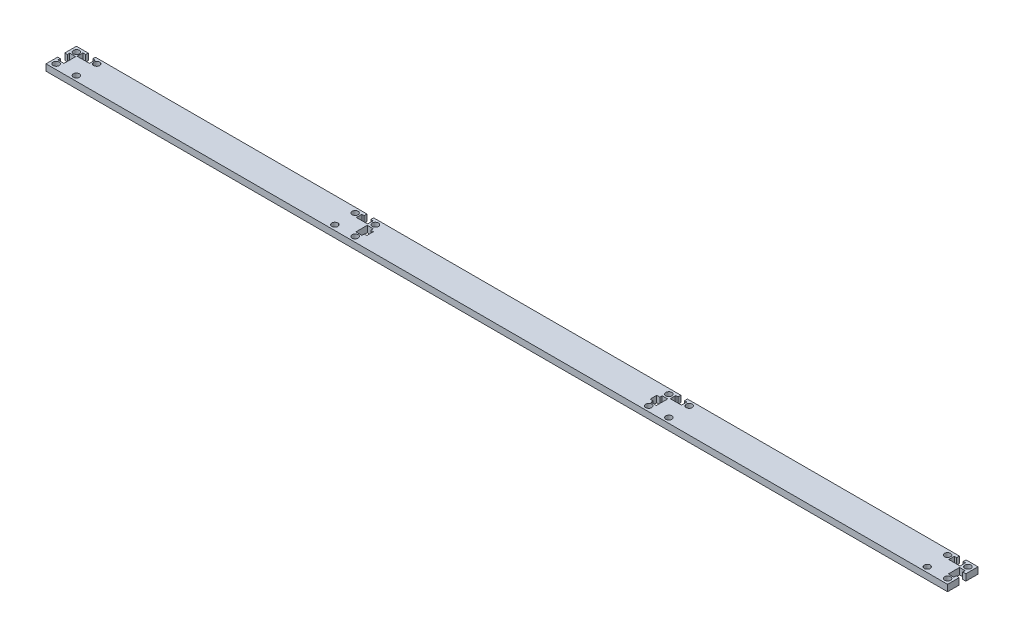
from build123d import *

# Parameters (mm, degrees)
SKETCH1_R           = 1.5
BOSS_EXTRUDE1_DEPTH = 3.175
CUT_EXTRUDE2_DEPTH  = 10
SKETCH6_W           = 2.65
SKETCH6_H           = 3.175
CUT_EXTRUDE3_DEPTH  = 0.25
CUT_EXTRUDE4_DEPTH  = 10
SKETCH10_W          = 5.8
SKETCH10_H          = 3.175
CUT_EXTRUDE5_DEPTH  = 0.762
SKETCH11_W          = 5.642946696
SKETCH11_H          = 3.772309887
CUT_EXTRUDE8_DEPTH  = 0.762
CUT_EXTRUDE10_DEPTH = 40.762
SKETCH16_W          = 5.568555148
SKETCH16_H          = 0.762
CUT_EXTRUDE12_DEPTH = 10.762
SKETCH17_W          = 0.762
SKETCH17_H          = 5.563896413
CUT_EXTRUDE13_DEPTH = 10.762
SKETCH18_W          = 5.525633157
SKETCH18_H          = 0.762
CUT_EXTRUDE14_DEPTH = 10.762
SKETCH19_W          = 0.762
SKETCH19_H          = 5.528063786
CUT_EXTRUDE15_DEPTH = 10.762
SKETCH20_W          = 5.526041358
SKETCH20_H          = 0.762
CUT_EXTRUDE16_DEPTH = 10.762
SKETCH21_W          = 3.556
SKETCH21_H          = 1.27
CUT_EXTRUDE17_DEPTH = 10.762
SKETCH22_W          = 6.120137849
SKETCH22_H          = 2.839580983
CUT_EXTRUDE18_DEPTH = 10


with BuildPart() as part:
    # Sketch1 → Boss-Extrude1 (new body)
    with BuildSketch(Plane(origin=(0, 0, 0), x_dir=(1, 0, 0), z_dir=(0, 1, 0))):
        Polygon((0, 7.5), (0, 0), (444.5, 0), (444.5, 15), (0, 15), align=None)
        with Locations((2.5, 2.5)):
            Circle(SKETCH1_R, mode=Mode.SUBTRACT)
        with Locations((12.5, 2.5)):
            Circle(SKETCH1_R, mode=Mode.SUBTRACT)
        with Locations((2.5, 12.5)):
            Circle(SKETCH1_R, mode=Mode.SUBTRACT)
        with Locations((12.5, 12.5)):
            Circle(SKETCH1_R, mode=Mode.SUBTRACT)
        with Locations((139.9, 2.5)):
            Circle(SKETCH1_R, mode=Mode.SUBTRACT)
        with Locations((149.9, 2.5)):
            Circle(SKETCH1_R, mode=Mode.SUBTRACT)
        with Locations((139.9, 12.5)):
            Circle(SKETCH1_R, mode=Mode.SUBTRACT)
        with Locations((149.9, 12.5)):
            Circle(SKETCH1_R, mode=Mode.SUBTRACT)
        with Locations((442, 12.5)):
            Circle(SKETCH1_R, mode=Mode.SUBTRACT)
        with Locations((294.6, 2.5)):
            Circle(SKETCH1_R, mode=Mode.SUBTRACT)
        with Locations((304.6, 2.5)):
            Circle(SKETCH1_R, mode=Mode.SUBTRACT)
        with Locations((432, 2.5)):
            Circle(SKETCH1_R, mode=Mode.SUBTRACT)
        with Locations((442, 2.5)):
            Circle(SKETCH1_R, mode=Mode.SUBTRACT)
        with Locations((294.6, 12.5)):
            Circle(SKETCH1_R, mode=Mode.SUBTRACT)
        with Locations((304.6, 12.5)):
            Circle(SKETCH1_R, mode=Mode.SUBTRACT)
        with Locations((432, 12.5)):
            Circle(SKETCH1_R, mode=Mode.SUBTRACT)
    extrude(amount=BOSS_EXTRUDE1_DEPTH)

    # Sketch4 → Cut-Extrude2 (cut)
    with BuildSketch(Plane(origin=(0, 3.175, 0), x_dir=(1, 0, 0), z_dir=(0, 1, 0))):
        Polygon((444.5, 5.75), (444.5, 9), (442.2, 9), (442.2, 10.15), (440.5, 10.15), (440.5, 7.5), (440.25, 7.5), (440.25, 4.6), (442.45, 4.6), (442.45, 5.75), align=None)
        Polygon((2.05, 9.25), (0, 9.25), (0, 5.75), (2.05, 5.75), (2.05, 4.6), (4.25, 4.6), (4.25, 10.4), (2.05, 10.4), align=None)
    extrude(amount=-CUT_EXTRUDE2_DEPTH, mode=Mode.SUBTRACT)

    # Sketch6 → Cut-Extrude3 (cut)
    with BuildSketch(Plane(origin=(440.5, 0, 0), x_dir=(0, 0, -1), z_dir=(1, 0, 0))):
        with Locations((8.825, 1.5875)):
            Rectangle(SKETCH6_W, SKETCH6_H)
    extrude(amount=-CUT_EXTRUDE3_DEPTH, mode=Mode.SUBTRACT)

    # Sketch7 → Cut-Extrude4 (cut)
    with BuildSketch(Plane(origin=(0, 3.175, 0), x_dir=(1, 0, 0), z_dir=(0, 1, 0))):
        Polygon((440.25, 10.15), (440.25, 4.6), (442.45, 4.6), (442.45, 5.75), (444.5, 5.75), (444.5, 9), (442.2, 9), (442.2, 10.15), align=None)
        Polygon((146.5, 13.1), (146.5, 15), (143.25, 15), (143.25, 12.85), (142.1, 12.85), (142.1, 10.9), (147.65, 10.9), (147.65, 13.1), align=None)
        Polygon((301.25, 12.85), (301.25, 15), (298, 15), (298, 13.1), (296.85, 13.1), (296.85, 10.9), (302.4, 10.9), (302.4, 12.85), align=None)
        Polygon((439.75, 10.9), (439.75, 13.1), (438.6, 13.1), (438.6, 15), (435.35, 15), (435.35, 12.85), (434.2, 12.85), (434.2, 10.9), align=None)
        Polygon((294.15, 5.75), (294.15, 4.6), (296.35, 4.6), (296.35, 10.15), (294.4, 10.15), (294.4, 9), (292.1, 9), (292.1, 5.75), align=None)
        Polygon((148.15, 10.15), (148.15, 4.6), (150.35, 4.6), (150.35, 5.75), (152.4, 5.75), (152.4, 9), (150.1, 9), (150.1, 10.15), align=None)
    extrude(amount=-CUT_EXTRUDE4_DEPTH, mode=Mode.SUBTRACT)

    # Sketch10 → Cut-Extrude5 (cut)
    with BuildSketch(Plane(origin=(2.05, 0, 0), x_dir=(0, 0, -1), z_dir=(1, 0, 0))):
        with Locations((7.5, 1.5875)):
            Rectangle(SKETCH10_W, SKETCH10_H)
    extrude(amount=-CUT_EXTRUDE5_DEPTH, mode=Mode.SUBTRACT)

    # Sketch11 → Cut-Extrude8 (cut)
    with BuildSketch(Plane.ZY.offset(-150.35)):
        with Locations((-7.421473348, 1.288845057)):
            Rectangle(SKETCH11_W, SKETCH11_H)
    extrude(amount=-CUT_EXTRUDE8_DEPTH, mode=Mode.SUBTRACT)

    # Sketch13 → Cut-Extrude10 (cut)
    with BuildSketch(Plane(origin=(0, 3.175, 0), x_dir=(1, 0, 0), z_dir=(0, 1, 0))):
        Polygon((151.112, 9.973556377), (151.112, 10.242946696), (148.15, 10.242946696), (148.15, 9.973556377), (149.018543237, 9.973556377), (149.018543237, 8.939623572), (150.569442445, 8.939623572), (150.569442445, 9.973556377), align=None)
    extrude(amount=-CUT_EXTRUDE10_DEPTH, mode=Mode.SUBTRACT)

    # Sketch16 → Cut-Extrude12 (cut)
    with BuildSketch(Plane(origin=(0, 3.175, 0), x_dir=(1, 0, 0), z_dir=(0, 1, 0))):
        with Locations((144.884277574, 13.231)):
            Rectangle(SKETCH16_W, SKETCH16_H)
    extrude(amount=-CUT_EXTRUDE12_DEPTH, mode=Mode.SUBTRACT)

    # Sketch17 → Cut-Extrude13 (cut)
    with BuildSketch(Plane(origin=(0, 3.175, 0), x_dir=(1, 0, 0), z_dir=(0, 1, 0))):
        with Locations((294.019, 7.368051794)):
            Rectangle(SKETCH17_W, SKETCH17_H)
    extrude(amount=-CUT_EXTRUDE13_DEPTH, mode=Mode.SUBTRACT)

    # Sketch18 → Cut-Extrude14 (cut)
    with BuildSketch(Plane(origin=(0, 3.175, 0), x_dir=(1, 0, 0), z_dir=(0, 1, 0))):
        with Locations((299.637183422, 13.231)):
            Rectangle(SKETCH18_W, SKETCH18_H)
    extrude(amount=-CUT_EXTRUDE14_DEPTH, mode=Mode.SUBTRACT)

    # Sketch19 → Cut-Extrude15 (cut)
    with BuildSketch(Plane(origin=(0, 3.175, 0), x_dir=(1, 0, 0), z_dir=(0, 1, 0))):
        with Locations((442.581, 7.385968107)):
            Rectangle(SKETCH19_W, SKETCH19_H)
    extrude(amount=-CUT_EXTRUDE15_DEPTH, mode=Mode.SUBTRACT)

    # Sketch20 → Cut-Extrude16 (cut)
    with BuildSketch(Plane(origin=(0, 3.175, 0), x_dir=(1, 0, 0), z_dir=(0, 1, 0))):
        with Locations((436.963020679, 13.231)):
            Rectangle(SKETCH20_W, SKETCH20_H)
    extrude(amount=-CUT_EXTRUDE16_DEPTH, mode=Mode.SUBTRACT)

    # Sketch21 → Cut-Extrude17 (cut)
    with BuildSketch(Plane(origin=(0, 3.175, 0), x_dir=(1, 0, 0), z_dir=(0, 1, 0))):
        with Locations((7.62, 14.365)):
            Rectangle(SKETCH21_W, SKETCH21_H)
    extrude(amount=-CUT_EXTRUDE17_DEPTH, mode=Mode.SUBTRACT)

    # Sketch22 → Cut-Extrude18 (cut)
    with BuildSketch(Plane(origin=(0, 3.175, 0), x_dir=(1, 0, 0), z_dir=(0, 1, 0))):
        with Locations((7.460637387, 12.310209509)):
            Rectangle(SKETCH22_W, SKETCH22_H)
    extrude(amount=-CUT_EXTRUDE18_DEPTH, mode=Mode.SUBTRACT)


solid = part.part
